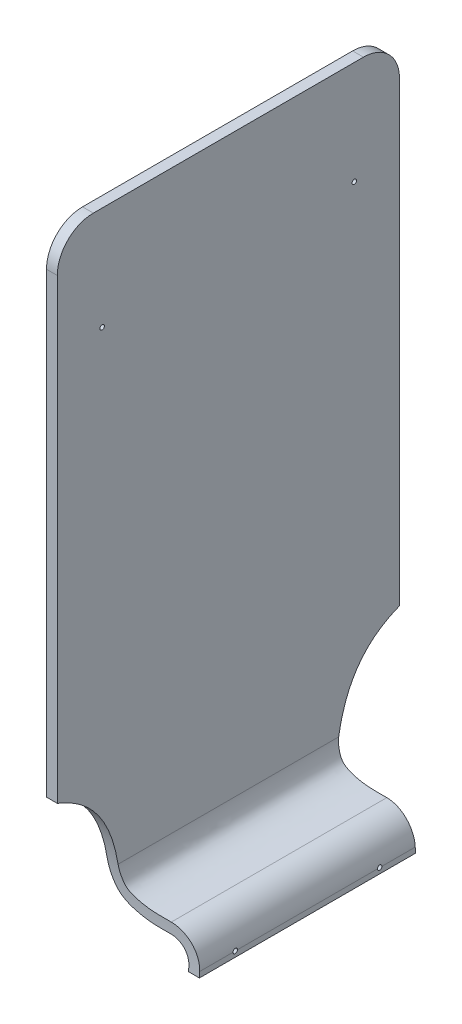
from build123d import *

# Parameters (mm, degrees)
EXTRUDE_THIN1_START     = -120.65
EXTRUDE_THIN1_DEPTH     = 241.3
FILLET1_R               = 25.4
FILLET2_R               = 25.4
CUT_EXTRUDE1_DEPTH      = 10.922
CUT_EXTRUDE1_DEPTH_BACK = 470.033978435
CUT_EXTRUDE2_DEPTH      = 14.224
CUT_EXTRUDE2_DEPTH_BACK = 17.78
SKETCH4_R               = 1.5875
CUT_EXTRUDE5_DEPTH      = 15.24
CUT_EXTRUDE5_DEPTH_BACK = 39.37
SKETCH6_R               = 1.5875


# Read off the part's stored shape, not the designer's step: Extrude-Thin1
with BuildPart() as part:
    # Extrude-Thin1 outline → Extrude-Thin1 (new body)
    with BuildSketch(Plane.XY.offset(EXTRUDE_THIN1_START)):
        with BuildLine():
            Line((-48.136484633, 42.398252654), (-48.136484633, 448.798252654))
            Line((-48.136484633, 448.798252654), (-55.756484633, 448.798252654))
            Line((-55.756484633, 448.798252654), (-55.756484633, 42.398252654))
            add(Edge.make_bspline(
                [(-12.565002774, 16.4226331), (-18.660422341, 16.648783951), (-29.593721838, 15.294803784), (-53.049054612, 24.063414555), (-55.748751869, 38.087730663), (-55.756484633, 42.398252654)],
                knots=[0, 0, 0, 0, 0.47979288, 0.674983069, 1, 1, 1, 1], degree=3))
            ThreePointArc((-12.565002774, 16.4226331), (-3.680204107, 12.742428993), (0, 3.857630326))
            Line((0, 3.857630326), (0, 0))
            Line((0, 0), (7.62, 0))
            Line((7.62, 0), (7.62, 3.857630326))
            ThreePointArc((7.62, 3.857630326), (1.761769959, 18.076558557), (-12.412488704, 24.042056908))
            add(Edge.make_bspline(
                [(-12.412488704, 24.042056908), (-14.262208623, 24.106140034), (-16.054759942, 24.078028651), (-19.666309734, 24.046159547), (-21.4850908, 24.039414372), (-25.260641796, 24.188692796), (-27.216781122, 24.343381658), (-30.330916862, 24.801554499), (-31.39895125, 24.992078959), (-33.055395991, 25.349419575), (-33.616606074, 25.480472941), (-34.758646701, 25.769107201), (-35.340221437, 25.926603185), (-37.052406147, 26.429710426), (-38.164623862, 26.811504496), (-40.201493957, 27.664037033), (-41.124128275, 28.13509499), (-42.284444288, 28.872281958), (-42.634290788, 29.122643674), (-43.100505125, 29.498715159), (-43.246220105, 29.624160936), (-43.450579345, 29.811881133), (-43.51636005, 29.874385921), (-43.649067646, 30.004760605), (-43.715258474, 30.071948921), (-44.309224288, 30.694807665), (-44.825849376, 31.382344205), (-45.776124403, 32.973984326), (-46.20816477, 33.875744733), (-46.944137411, 35.767951586), (-47.248356988, 36.757617062), (-47.719156141, 38.676711786), (-47.885935678, 39.606985364), (-48.042550102, 40.82976044), (-48.079286167, 41.208412507), (-48.125975073, 41.878883872), (-48.135737799, 42.17124376), (-48.136484633, 42.398252654)],
                knots=[0, 0, 0, 0, 0.125, 0.125, 0.25, 0.25, 0.375, 0.375, 0.4375, 0.4375, 0.46875, 0.46875, 0.5, 0.5, 0.5625, 0.5625, 0.625, 0.625, 0.65625, 0.65625, 0.671875, 0.671875, 0.6796875, 0.6796875, 0.6875, 0.6875, 0.75, 0.75, 0.8125, 0.8125, 0.875, 0.875, 0.9375, 0.9375, 0.96875, 0.96875, 1, 1, 1, 1], degree=3))
        make_face()
    extrude(amount=EXTRUDE_THIN1_DEPTH)

    # Fillet1
    fillet1_edges = [part.edges().sort_by_distance(p)[0] for p in [
        (-51.946484633, 448.798252654, 120.65),
    ]]
    fillet(fillet1_edges, radius=FILLET1_R)

    # Fillet2
    fillet2_edges = [part.edges().sort_by_distance(p)[0] for p in [
        (-51.946484633, 448.798252654, -120.65),
    ]]
    fillet(fillet2_edges, radius=FILLET2_R)

    # Sketch3 → Cut-Extrude1 (cut, two sides: drawn at the far end of the back side and taken through both)
    with BuildSketch(Plane(origin=(7.62, 0, 0), x_dir=(0, 0, -1), z_dir=(1, 0, 0)).offset(-CUT_EXTRUDE1_DEPTH_BACK)):
        with BuildLine():
            Line((-120.65, 0), (-76.2, 0))
            add(Edge.make_bspline(
                [(-76.2, 0), (-73.040659179, 57.986016849), (-88.101358348, 88.292728392), (-120.65, 100.991245088)],
                knots=[0, 0, 0, 0, 1, 1, 1, 1], degree=3))
            Line((-120.65, 100.991245088), (-120.65, 0))
        make_face()
        with BuildLine():
            Line((120.65, 0), (76.2, 0))
            add(Edge.make_bspline(
                [(76.2, 0), (73.040659179, 57.986016849), (88.101358348, 88.292728392), (120.65, 100.991245088)],
                knots=[0, 0, 0, 0, 1, 1, 1, 1], degree=3))
            Line((120.65, 100.991245088), (120.65, 0))
        make_face()
    extrude(amount=CUT_EXTRUDE1_DEPTH + CUT_EXTRUDE1_DEPTH_BACK, mode=Mode.SUBTRACT)

    # Sketch4 → Cut-Extrude2 (cut, two sides: drawn at the far end of the back side and taken through both)
    with BuildSketch(Plane(origin=(-48.136484633, 0, 0), x_dir=(0, 0, -1), z_dir=(1, 0, 0)).offset(-CUT_EXTRUDE2_DEPTH_BACK)):
        with Locations(Location((-89.003908419, 375.92, 0), (0, 0, 180))):
            Circle(SKETCH4_R)
        with Locations(Location((88.803751124, 375.92, 0), (0, 0, 180))):
            Circle(SKETCH4_R)
    extrude(amount=CUT_EXTRUDE2_DEPTH + CUT_EXTRUDE2_DEPTH_BACK, mode=Mode.SUBTRACT)

    # Sketch6 → Cut-Extrude5 (cut, two sides: drawn at the far end of the back side and taken through both)
    with BuildSketch(Plane(origin=(7.62, 0, 0), x_dir=(0, 0, -1), z_dir=(1, 0, 0)).offset(-CUT_EXTRUDE5_DEPTH_BACK)):
        with Locations(Location((-50.940117855, 3.857630326, 0), (0, 0, 180))):
            Circle(SKETCH6_R)
        with Locations(Location((50.940117855, 3.857630326, 0), (0, 0, 180))):
            Circle(SKETCH6_R)
    extrude(amount=CUT_EXTRUDE5_DEPTH + CUT_EXTRUDE5_DEPTH_BACK, mode=Mode.SUBTRACT)


solid = part.part
